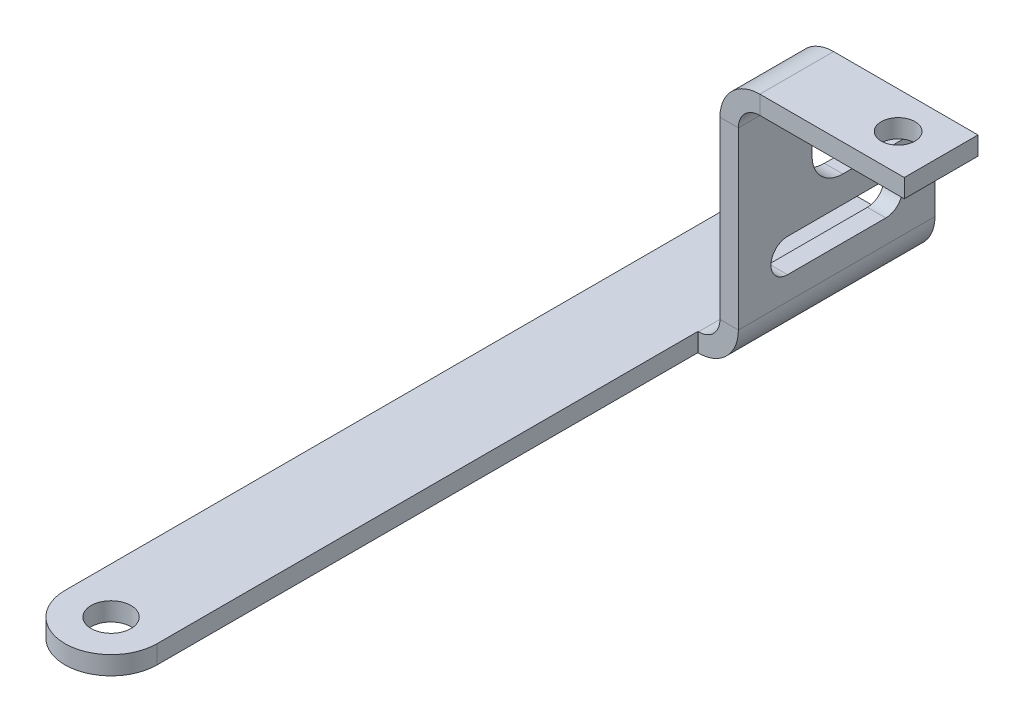
from build123d import *

# Parameters (mm, degrees)
SKETCH1_R            = 3.25
BOSS_EXTRUDE1_DEPTH  = 3
EDGE_FLANGE1_DEPTH   = 32
SKETCH12_W           = 12
SKETCH12_H           = 15
BOSS_EXTRUDE2_DEPTH  = 3
EDGE_FLANGE3_DEPTH   = 12
CUT_EXTRUDE1_DEPTH   = 131.469345059
FILLET1_R            = 5
M5_CLEARANCE_HOLE1_D = 5.5


# Sheet-metal steps are written as plain solids
with BuildPart() as part:
    # Sketch1 → Boss-Extrude1 (new body)
    with BuildSketch(Plane(origin=(0, 0, 0), x_dir=(1, 0, 0), z_dir=(0, 1, 0))):
        with BuildLine():
            Line((-7.5, 0), (-7.5, 120))
            Line((-7.5, 120), (7.6, 120))
            Line((7.6, 120), (7.6, 88))
            Line((7.6, 88), (7.5, 88))
            Line((7.5, 88), (7.5, 0))
            ThreePointArc((7.5, 0), (0, -7.5), (-7.5, 0))
        make_face()
        with Locations(Location((0, 0, 0), (0, 0, 270))):
            Circle(SKETCH1_R, mode=Mode.SUBTRACT)
    extrude(amount=BOSS_EXTRUDE1_DEPTH)

    # Edge-Flange1 section (across the edge) → Edge-Flange1 (add)
    with BuildSketch(Plane(origin=(11.1, 3, -88), x_dir=(-1, 0, 0), z_dir=(0, 0, -1))):
        with BuildLine():
            Line((-3, 3.5), (-3, 17))
            Line((-3, 17), (0, 17))
            Line((0, 17), (0, 3.5))
            ThreePointArc((0, 3.5), (1.025126266, 1.025126266), (3.5, 0))
            Line((3.5, 0), (3.5, -3))
            ThreePointArc((3.5, -3), (-1.096194078, -1.096194078), (-3, 3.5))
        make_face()
    extrude(amount=EDGE_FLANGE1_DEPTH)

    # Sketch12 → Boss-Extrude2 (add)
    with BuildSketch(Plane.ZY.offset(-11.1)):
        with Locations((-94, 27.5)):
            Rectangle(SKETCH12_W, SKETCH12_H)
    extrude(amount=-BOSS_EXTRUDE2_DEPTH)

    # Edge-Flange3 section (across the edge) → Edge-Flange3 (add)
    with BuildSketch(Plane(origin=(14.1, 38.5, -100), x_dir=(0, -1, 0), z_dir=(0, 0, 1))):
        with BuildLine():
            Line((-3, 3.5), (-3, 27))
            Line((-3, 27), (0, 27))
            Line((0, 27), (0, 3.5))
            ThreePointArc((0, 3.5), (1.025126266, 1.025126266), (3.5, 0))
            Line((3.5, 0), (3.5, -3))
            ThreePointArc((3.5, -3), (-1.096194078, -1.096194078), (-3, 3.5))
        make_face()
    extrude(amount=EDGE_FLANGE3_DEPTH)

    # Sketch16 → Cut-Extrude1 (cut, through all)
    with BuildSketch(Plane.ZY.offset(-11.1)):
        with BuildLine():
            Line((-112, 15.7), (-96, 15.7))
            ThreePointArc((-96, 15.7), (-93.3, 13), (-96, 10.3))
            Line((-96, 10.3), (-112, 10.3))
            ThreePointArc((-112, 10.3), (-114.7, 13), (-112, 15.7))
        make_face()
    extrude(amount=-CUT_EXTRUDE1_DEPTH, mode=Mode.SUBTRACT)

    # Fillet1
    fillet1_edges = [part.edges().sort_by_distance(p)[0] for p in [
        (12.6, 20, -120),
        (12.6, 20, -100),
    ]]
    fillet(fillet1_edges, radius=FILLET1_R)

    # M5 Clearance Hole1 (through all)
    with Locations(Plane(origin=(0, 41.5, 0), x_dir=(1, 0, 0), z_dir=(0, 1, 0))):
        with Locations((34.1, 94)):
            Hole(M5_CLEARANCE_HOLE1_D / 2)


solid = part.part
